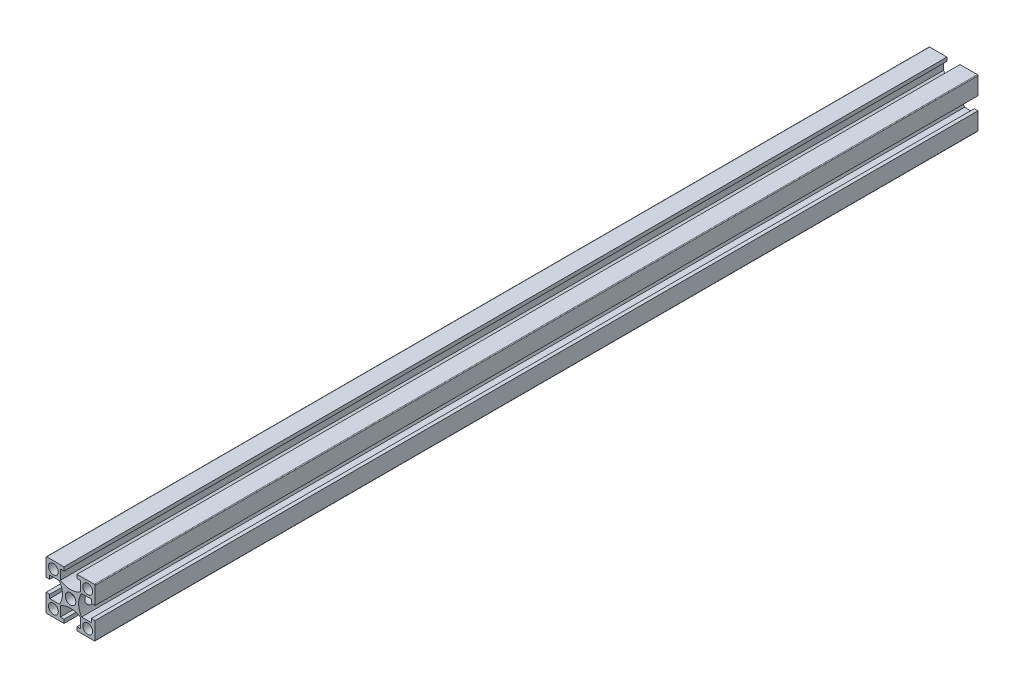
from build123d import *

# Parameters (mm, degrees)
SKETCH_1_W               = 20
SKETCH_1_H               = 20
SKETCH_1_R               = 2
SKETCH_1_R_2             = 2.15
EXTRUDE_1_DEPTH          = 360
CUT_EXTRUDE_1_REACH      = 362.278
PATTERN_CIRCULAR_1_COUNT = 4
FILLET_1_R               = 0.3
CUT_EXTRUDE_2_DEPTH      = 361.277670693
CUT_EXTRUDE_2_DEPTH_BACK = 361.277670693
SKETCH_2_R               = 2.5
SKETCH_4_R               = 2.5
CUT_EXTRUDE_4_DEPTH      = 361.693776037


with BuildPart() as part:
    # 스케치1 → 보스-돌출1 (new body)
    with BuildSketch(Plane.XY):
        Rectangle(SKETCH_1_W, SKETCH_1_H)
        with Locations((-7, -7)):
            Circle(SKETCH_1_R, mode=Mode.SUBTRACT)
        with Locations((7, -7)):
            Circle(SKETCH_1_R, mode=Mode.SUBTRACT)
        with Locations((-7, 7)):
            Circle(SKETCH_1_R, mode=Mode.SUBTRACT)
        Circle(SKETCH_1_R_2, mode=Mode.SUBTRACT)
        with Locations((7, 7)):
            Circle(SKETCH_1_R, mode=Mode.SUBTRACT)
    extrude(amount=EXTRUDE_1_DEPTH)

    # 스케치1<3> → 컷-돌출1 (cut, up to next)
    with BuildSketch(Plane.XY, mode=Mode.PRIVATE) as cut_extrude_1_sk1:
        with BuildLine():
            Line((-8.5, 2.65), (-10, 2.65))
            Line((-10, 2.65), (-10, -2.65))
            Line((-10, -2.65), (-8.5, -2.65))
            Line((-8.5, -2.65), (-8.5, -4.15))
            Line((-8.5, -4.15), (-4.503166667, -4.15))
            ThreePointArc((-4.503166667, -4.15), (-3.3, 0), (-4.503166667, 4.15))
            Line((-4.503166667, 4.15), (-8.5, 4.15))
            Line((-8.5, 4.15), (-8.5, 2.65))
        make_face()
    cut_extrude_1_tool1 = extrude(cut_extrude_1_sk1.sketch, amount=CUT_EXTRUDE_1_REACH, mode=Mode.PRIVATE) & part.part
    cut_extrude_1 = cut_extrude_1_tool1.solids().sort_by_distance((-6.606913, 0, 0))[0]
    add(cut_extrude_1, mode=Mode.SUBTRACT)

    # 원형 패턴1: 컷-돌출1 ×4 about axis
    pattern_circular_1_axis = Axis((0, 0, 360), (0, 0, -1))
    for i in range(1, PATTERN_CIRCULAR_1_COUNT):
        add(cut_extrude_1.rotate(pattern_circular_1_axis, i * 360 / PATTERN_CIRCULAR_1_COUNT), mode=Mode.SUBTRACT)

    # 필렛1
    fillet_1_edges = [part.edges().sort_by_distance(p)[0] for p in [
        (10, -10, 180),
        (-10, -10, 180),
        (-10, 10, 180),
        (10, 10, 180),
    ]]
    fillet(fillet_1_edges, radius=FILLET_1_R)

    # 스케치2 → 컷-돌출2 (cut, two sides: drawn at the far end of the back side and taken through both)
    with BuildSketch(Plane(origin=(0, 0, 0), x_dir=(0, 0, -1), z_dir=(1, 0, 0)).offset(-CUT_EXTRUDE_2_DEPTH_BACK)):
        with Locations((-5, 0)):
            Circle(SKETCH_2_R)
        with Locations((-355, 0)):
            Circle(SKETCH_2_R)
    extrude(amount=CUT_EXTRUDE_2_DEPTH + CUT_EXTRUDE_2_DEPTH_BACK, mode=Mode.SUBTRACT)

    # 스케치4 → 컷-돌출4 (cut, through all)
    with BuildSketch(Plane(origin=(10, 0, 0), x_dir=(0, 0, -1), z_dir=(1, 0, 0))):
        with Locations((-316.35, 0)):
            Circle(SKETCH_4_R)
        with Locations((-183.38, 0)):
            Circle(SKETCH_4_R)
        with Locations((-23.9, 0)):
            Circle(SKETCH_4_R)
    extrude(amount=-CUT_EXTRUDE_4_DEPTH, mode=Mode.SUBTRACT)


solid = part.part
